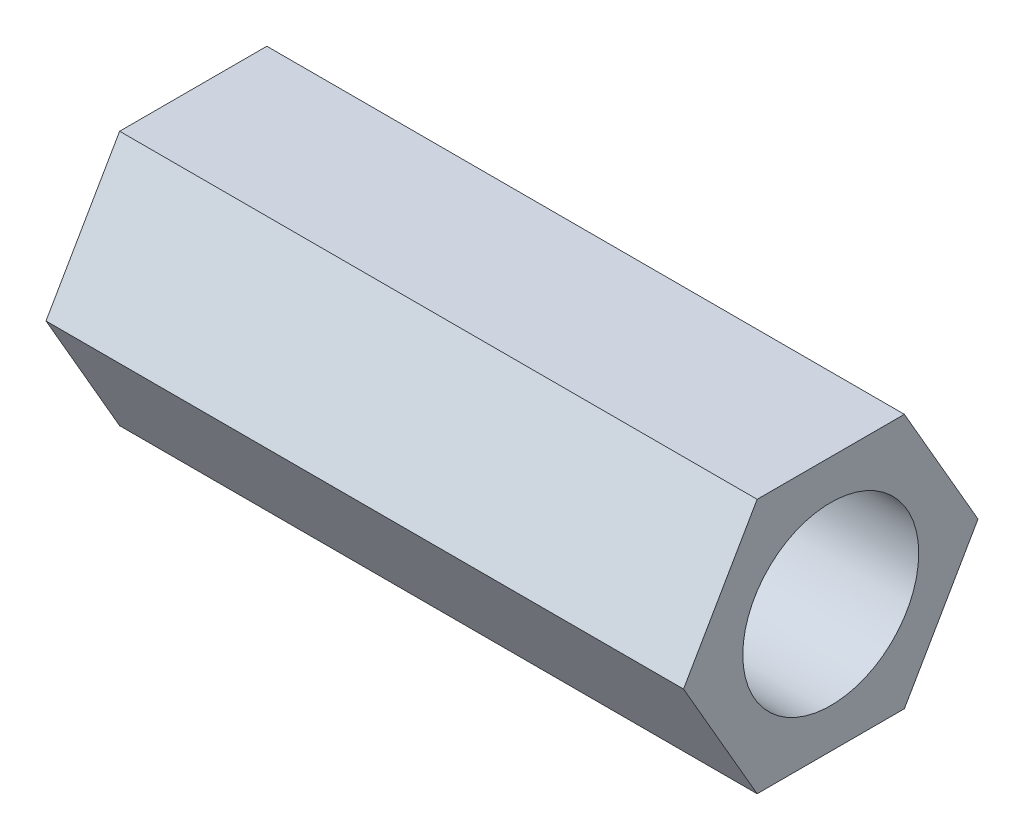
from build123d import *

# Parameters (mm, degrees)
BOSS_EXTRUDE1_DEPTH = 31.75
SKETCH2_R           = 4.381000001
CUT_EXTRUDE1_DEPTH  = 34.198619449


with BuildPart() as part:
    # Sketch1 → Boss-Extrude1 (new body)
    with BuildSketch(Plane(origin=(0, 0, 0), x_dir=(0, 0, -1), z_dir=(1, 0, 0))):
        Polygon((7.332348419, 0), (3.666174209, 6.35), (-3.666174209, 6.35), (-7.332348419, 0), (-3.666174209, -6.35), (3.666174209, -6.35), align=None)
    extrude(amount=BOSS_EXTRUDE1_DEPTH)

    # Sketch2 → Cut-Extrude1 (cut, through all)
    with BuildSketch(Plane(origin=(31.75, 0, 0), x_dir=(0, 0, -1), z_dir=(1, 0, 0))):
        Circle(SKETCH2_R)
    extrude(amount=-CUT_EXTRUDE1_DEPTH, mode=Mode.SUBTRACT)


solid = part.part
